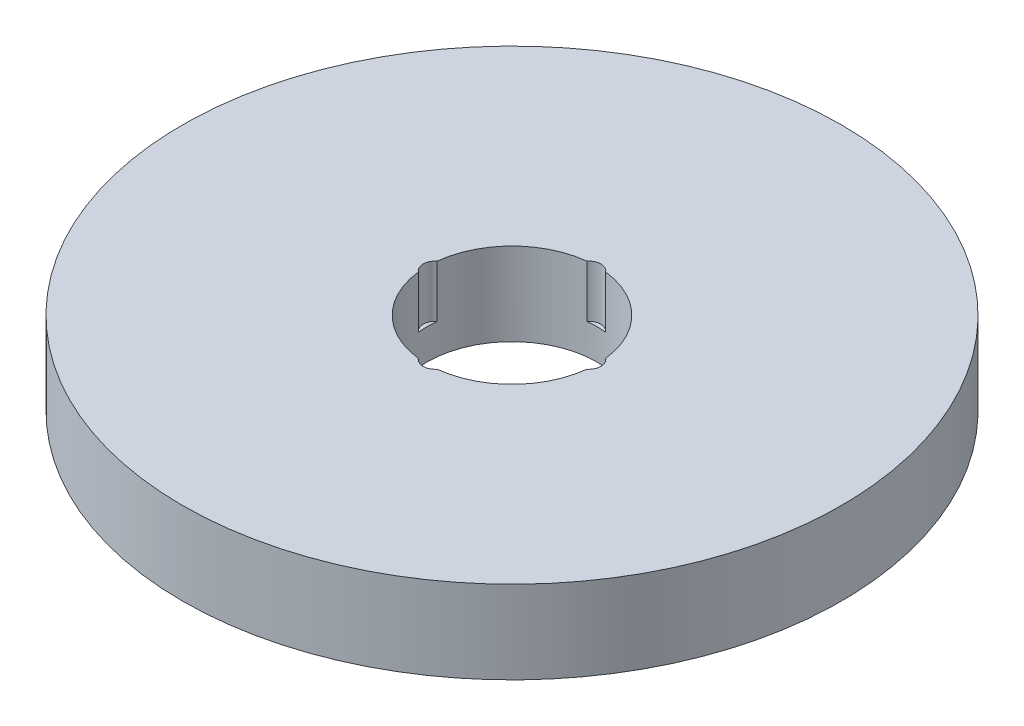
from build123d import *

# Parameters (mm, degrees)
SKETCH1_R           = 87.5
BOSS_EXTRUDE1_DEPTH = 22
SKETCH2_R           = 22.5
CUT_EXTRUDE1_DEPTH  = 126.684127876
SKETCH3_R           = 3.221594757
CUT_EXTRUDE2_DEPTH  = 13.861414588
CIRPATTERN1_COUNT   = 4


with BuildPart() as part:
    # Sketch1 → Boss-Extrude1 (new body)
    with BuildSketch(Plane(origin=(0, 0, 0), x_dir=(1, 0, 0), z_dir=(0, 1, 0))):
        Circle(SKETCH1_R)
    extrude(amount=BOSS_EXTRUDE1_DEPTH)

    # Sketch2 → Cut-Extrude1 (cut, through all)
    with BuildSketch(Plane(origin=(0, 0, 0), x_dir=(1, 0, 0), z_dir=(0, 1, 0))):
        Circle(SKETCH2_R)
    extrude(amount=CUT_EXTRUDE1_DEPTH, mode=Mode.SUBTRACT)

    # Sketch3 → Cut-Extrude2 (cut)
    with BuildSketch(Plane(origin=(0, 22, 0), x_dir=(1, 0, 0), z_dir=(0, 1, 0))):
        with Locations((-20.342853519, 0)):
            Circle(SKETCH3_R)
    cut_extrude2 = extrude(amount=-CUT_EXTRUDE2_DEPTH, mode=Mode.SUBTRACT)

    # CirPattern1: Cut-Extrude2 ×4 about axis
    cirpattern1_axis = Axis((0, 0, 0), (0, 1, 0))
    for i in range(1, CIRPATTERN1_COUNT):
        add(cut_extrude2.rotate(cirpattern1_axis, i * 360 / CIRPATTERN1_COUNT), mode=Mode.SUBTRACT)


solid = part.part
